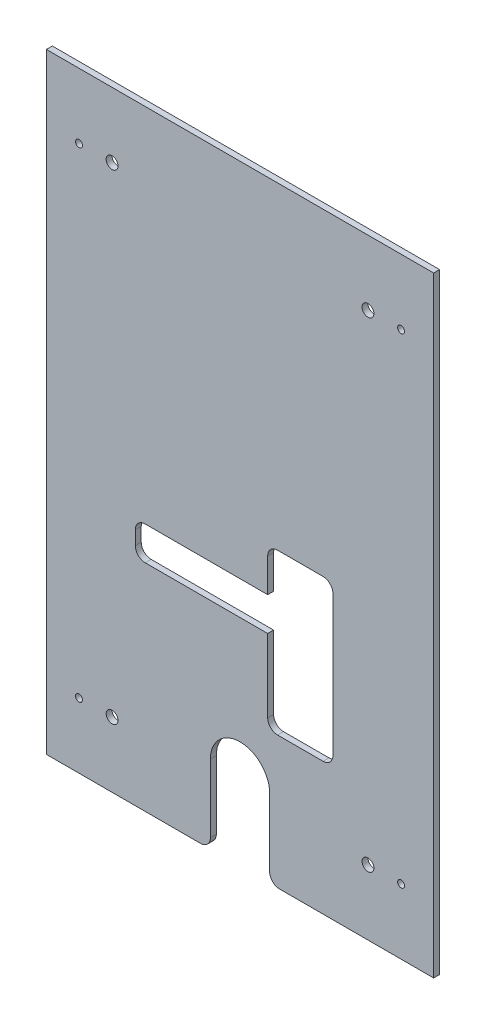
from build123d import *

# Parameters (mm, degrees)
ESQUISSE1_W             = 196
ESQUISSE1_H             = 309
ESQUISSE1_R             = 1.75
ESQUISSE1_R_2           = 3
BOSS_EXTRU_1_DEPTH      = 3
ENL_V_MAT_EXTRU_1_REACH = 184.984
CONG_1_R                = 5
ENL_V_MAT_EXTRU_2_DEPTH = 183.984288943
CONG_2_R                = 5


with BuildPart() as part:
    # Esquisse1 → Boss.-Extru.1 (new body)
    with BuildSketch(Plane.XY):
        Rectangle(ESQUISSE1_W, ESQUISSE1_H)
        with Locations((-81.5, 121.5)):
            Circle(ESQUISSE1_R, mode=Mode.SUBTRACT)
        with Locations((81.5, 121.5)):
            Circle(ESQUISSE1_R, mode=Mode.SUBTRACT)
        with Locations((81.5, -121.5)):
            Circle(ESQUISSE1_R, mode=Mode.SUBTRACT)
        with Locations((-81.5, -121.5)):
            Circle(ESQUISSE1_R, mode=Mode.SUBTRACT)
        with Locations((64.75, 121.5)):
            Circle(ESQUISSE1_R_2, mode=Mode.SUBTRACT)
        with Locations((-64.75, 121.5)):
            Circle(ESQUISSE1_R_2, mode=Mode.SUBTRACT)
        with Locations((-64.75, -121.5)):
            Circle(ESQUISSE1_R_2, mode=Mode.SUBTRACT)
        with Locations((64.75, -121.5)):
            Circle(ESQUISSE1_R_2, mode=Mode.SUBTRACT)
    extrude(amount=BOSS_EXTRU_1_DEPTH)

    # Esquisse2 → Enlèv. mat.-Extru.1 (cut, up to next)
    with BuildSketch(Plane.XY.offset(3), mode=Mode.PRIVATE) as enl_v_mat_extru_1_sk1:
        with BuildLine():
            Line((-15, -154.5), (-15, -115))
            ThreePointArc((-15, -115), (0, -100), (15, -115))
            Line((15, -115), (15, -154.5))
            ThreePointArc((15, -154.5), (0, -169.5), (-15, -154.5))
        make_face()
    enl_v_mat_extru_1_tool1 = extrude(enl_v_mat_extru_1_sk1.sketch, amount=-ENL_V_MAT_EXTRU_1_REACH, mode=Mode.PRIVATE) & part.part
    add(enl_v_mat_extru_1_tool1.solids().sort_by_distance((0, -134.75, 3))[0], mode=Mode.SUBTRACT)

    # Congé1
    cong_1_edges = [part.edges().sort_by_distance(p)[0] for p in [
        (15, -154.5, 1.5),
        (-15, -154.5, 1.5),
    ]]
    fillet(cong_1_edges, radius=CONG_1_R)

    # Esquisse3 → Enlèv. mat.-Extru.2 (cut, through all)
    with BuildSketch(Plane.XY.offset(3)):
        Polygon((-53, -28.5), (14, -28.5), (14, -6.5), (47, -6.5), (47, -87.5), (14, -87.5), (14, -45.5), (-53, -45.5), align=None)
    extrude(amount=-ENL_V_MAT_EXTRU_2_DEPTH, mode=Mode.SUBTRACT)

    # Congé2
    cong_2_edges = [part.edges().sort_by_distance(p)[0] for p in [
        (-53, -45.5, 1.5),
        (-53, -28.5, 1.5),
        (14, -87.5, 1.5),
        (47, -87.5, 1.5),
        (47, -6.5, 1.5),
        (14, -6.5, 1.5),
    ]]
    fillet(cong_2_edges, radius=CONG_2_R)


solid = part.part
